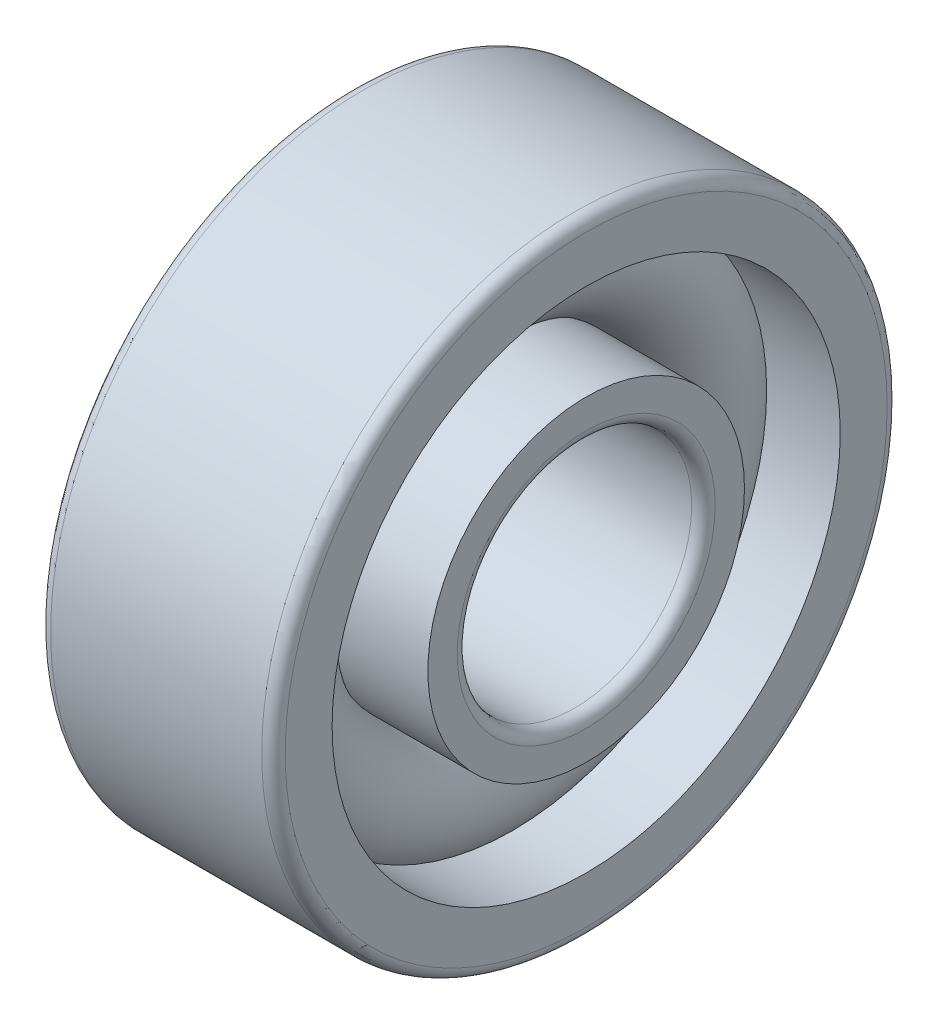
from build123d import *

# Parameters (mm, degrees)
CAGSPISKE_W     = 0.375
CAGSPISKE_H     = 0.25
CAGESPINE_ANGLE = 0.001
BALSIMSKE_R     = 0.75


with BuildPart() as part:
    # CagSpiSke → CageSpine (revolve)
    with BuildSketch(Plane.XY):
        with Locations((0, 2.75)):
            Rectangle(CAGSPISKE_W, CAGSPISKE_H)
    revolve(axis=Axis((-20.6375, 0, 0), (1, 0, 0)), revolution_arc=CAGESPINE_ANGLE)

    # BalSimSke → BallsSimplified (revolve)
    with BuildSketch(Plane.XY):
        with Locations((0, 2.75)):
            Circle(BALSIMSKE_R)
    revolve(axis=Axis((-10, 0, 0), (1, 0, 0)))

    # InnRacSke → InnerRace (revolve)
    with BuildSketch(Plane.XY):
        with BuildLine():
            Line((-0.525, 2.25), (-1.5, 2.25))
            Line((-1.5, 2.25), (-1.5, 1.65))
            ThreePointArc((-1.5, 1.65), (-1.456066017, 1.543933983), (-1.35, 1.5))
            Line((-1.35, 1.5), (1.35, 1.5))
            ThreePointArc((1.35, 1.5), (1.456066017, 1.543933983), (1.5, 1.65))
            Line((1.5, 1.65), (1.5, 2.025))
            Line((1.5, 2.025), (0, 2.025))
            ThreePointArc((0, 2.025), (-0.285591491, 2.083619853), (-0.525, 2.25))
        make_face()
    revolve(axis=Axis((-20.6375, 0, 0), (1, 0, 0)))

    # OutRacSke → OuterRace (revolve)
    with BuildSketch(Plane.XY):
        with BuildLine():
            Line((0, 3.475), (-1.5, 3.475))
            Line((-1.5, 3.475), (-1.5, 3.85))
            ThreePointArc((-1.5, 3.85), (-1.456066017, 3.956066017), (-1.35, 4))
            Line((-1.35, 4), (1.35, 4))
            ThreePointArc((1.35, 4), (1.456066017, 3.956066017), (1.5, 3.85))
            Line((1.5, 3.85), (1.5, 3.25))
            Line((1.5, 3.25), (0.525, 3.25))
            ThreePointArc((0.525, 3.25), (0.285591491, 3.416380147), (0, 3.475))
        make_face()
    revolve(axis=Axis((-20.6375, 0, 0), (1, 0, 0)))


solid = part.part
